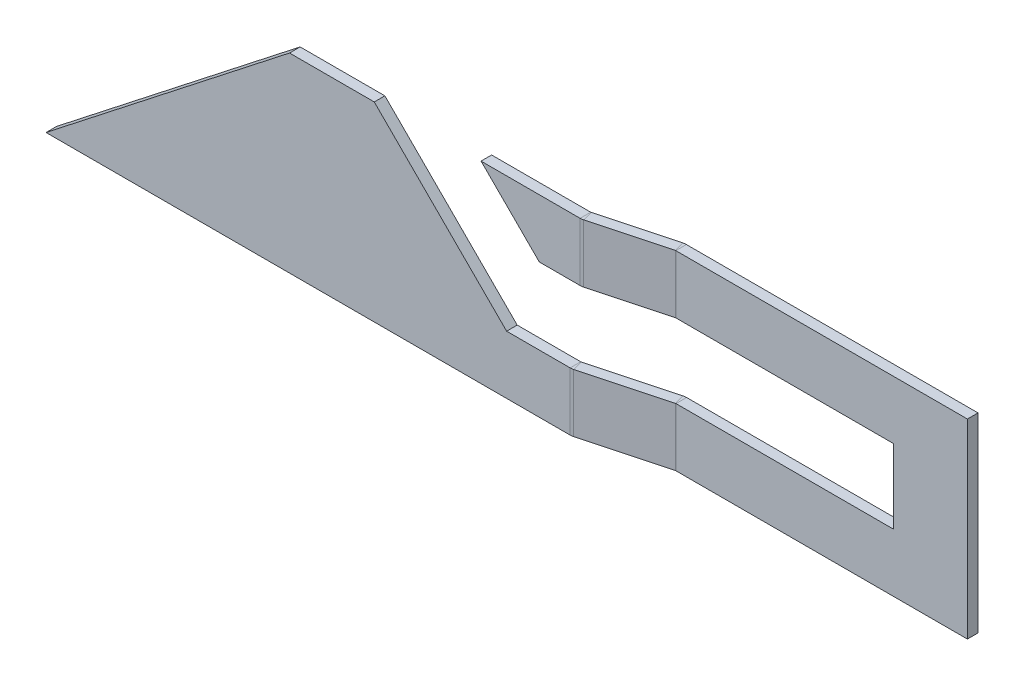
from build123d import *

# Parameters (mm, degrees)
BASE_FLANGE1_DEPTH       = 5
EDGE_FLANGE1_DEPTH       = 27.5
EDGE_FLANGE2_DEPTH       = 27.5
EDGE_FLANGE2_START       = 62.5
EDGE_FLANGE2_2_OUTLINE_W = 137.70274344
EDGE_FLANGE2_2_OUTLINE_H = 5
EDGE_FLANGE2_2_DEPTH     = 27.5
EDGE_FLANGE2_START_2     = 27.5
EDGE_FLANGE2_3_OUTLINE_W = 35
EDGE_FLANGE2_3_OUTLINE_H = 5
EDGE_FLANGE2_3_DEPTH     = 35
EDGE_FLANGE3_DEPTH       = 27.5
EDGE_FLANGE4_DEPTH       = 27.5
EDGE_FLANGE4_START       = 5
EDGE_FLANGE4_FLAT_DEPTH  = 5


# Read off the part's stored shape, not the designer's step: Edge-Flange2
# Sheet-metal steps are written as plain solids
with BuildPart() as part:
    # Sketch1 → Base-Flange1 (new body)
    with BuildSketch(Plane.XY):
        Polygon((0, 0), (-117.7971995, 0), (-2.7971995, 90), (37.2028005, 90), (99.7028005, 27.5), (129.7028005, 27.5), (129.7028005, 0), align=None)
    extrude(amount=-BASE_FLANGE1_DEPTH)

    # Edge-Flange1 section (across the edge) → Edge-Flange1 (add)
    with BuildSketch(Plane(origin=(129.79977573, 27.5, -5), x_dir=(-0.2588190451025146, 0, -0.96592582628907), z_dir=(0, -1, 0))):
        with BuildLine():
            Line((-5, 0.09697523), (-5, 39.341737512))
            Line((-5, 39.341737512), (0, 39.341737512))
            Line((0, 39.341737512), (0, 0.09697523))
            ThreePointArc((0, 0.09697523), (0.006301715, 0.000829637), (0.025099036, -0.093670879))
            Line((0.025099036, -0.093670879), (-4.804530095, -1.387766104))
            ThreePointArc((-4.804530095, -1.387766104), (-4.950922592, -0.651801325), (-5, 0.09697523))
        make_face()
    extrude(amount=EDGE_FLANGE1_DEPTH)

    # Edge-Flange2 outline → Edge-Flange2 (add)
    with BuildSketch(Plane(origin=(0, 0, 0), x_dir=(1, 0, 0), z_dir=(0, 1, 0))):
        with BuildLine():
            ThreePointArc((169.285717378, 15.37786084), (168.536940824, 15.328783432), (167.800976044, 15.182390936))
            Line((167.800976044, 15.182390936), (169.09507127, 10.352761804))
            ThreePointArc((169.09507127, 10.352761804), (169.189571785, 10.371559125), (169.285717378, 10.37786084))
            Line((169.285717378, 10.37786084), (306.891485589, 10.37786084))
            Line((306.891485589, 10.37786084), (306.891485589, 15.37786084))
            Line((306.891485589, 15.37786084), (169.285717378, 15.37786084))
        make_face()
    extrude(amount=EDGE_FLANGE2_DEPTH)



with BuildPart() as body_2:
    # Edge-Flange2 2 outline → Edge-Flange2 2 (new body)
    with BuildSketch(Plane(origin=(0, 0, 0), x_dir=(1, 0, 0), z_dir=(0, 1, 0)).offset(EDGE_FLANGE2_START)):
        with Locations((238.040113869, 12.87786084)):
            Rectangle(EDGE_FLANGE2_2_OUTLINE_W, EDGE_FLANGE2_2_OUTLINE_H)
    extrude(amount=EDGE_FLANGE2_2_DEPTH)


with BuildPart() as part_1:
    add(part.part)

    add(body_2.part)  # Edge-Flange2 3 merges body 2
    # Edge-Flange2 3 outline → Edge-Flange2 3 (add)
    with BuildSketch(Plane(origin=(0, 0, 0), x_dir=(1, 0, 0), z_dir=(0, 1, 0)).offset(EDGE_FLANGE2_START_2)):
        with Locations((289.391485589, 12.87786084)):
            Rectangle(EDGE_FLANGE2_3_OUTLINE_W, EDGE_FLANGE2_3_OUTLINE_H)
    extrude(amount=EDGE_FLANGE2_3_DEPTH)

    # Edge-Flange3 section (across the edge) → Edge-Flange3 (add)
    with BuildSketch(Plane(origin=(169.091766919, 90, -10.37786084), x_dir=(0.2588190451025146, 0, 0.96592582628907), z_dir=(0, -1, 0))):
        with BuildLine():
            Line((-5, 0.09697523), (-5, 35.422092475))
            Line((-5, 35.422092475), (0, 35.422092475))
            Line((0, 35.422092475), (0, 0.09697523))
            ThreePointArc((0, 0.09697523), (0.006301715, 0.000829637), (0.025099036, -0.093670879))
            Line((0.025099036, -0.093670879), (-4.804530095, -1.387766104))
            ThreePointArc((-4.804530095, -1.387766104), (-4.950922592, -0.651801325), (-5, 0.09697523))
        make_face()
    extrude(amount=EDGE_FLANGE3_DEPTH)

    # Edge-Flange4 bend section (across the edge) → Edge-Flange4 (add)
    with BuildSketch(Plane(origin=(133.488886871, 62.5, -6.014478786), x_dir=(0, 0, -1), z_dir=(0, 1, 0))):
        with BuildLine():
            Line((-5, 0.09697523), (0, 0.09697523))
            ThreePointArc((0, 0.09697523), (0.006301715, 0.000829637), (0.025099036, -0.093670879))
            Line((0.025099036, -0.093670879), (-4.804530095, -1.387766104))
            ThreePointArc((-4.804530095, -1.387766104), (-4.950922592, -0.651801325), (-5, 0.09697523))
        make_face()
    extrude(amount=EDGE_FLANGE4_DEPTH)

    # Edge-Flange4 profile (on flange) → Edge-Flange4 flat (add)
    with BuildSketch(Plane(origin=(133.488886871, 0, -6.014478786), x_dir=(0, 1, 0), z_dir=(0, 0, 1)).offset(EDGE_FLANGE4_START)):
        Polygon((62.5, 19.382282567), (62.5, 0.09697523), (90, 0.09697523), (90, 46.882282567), align=None)
    extrude(amount=-EDGE_FLANGE4_FLAT_DEPTH)


solid = part_1.part
